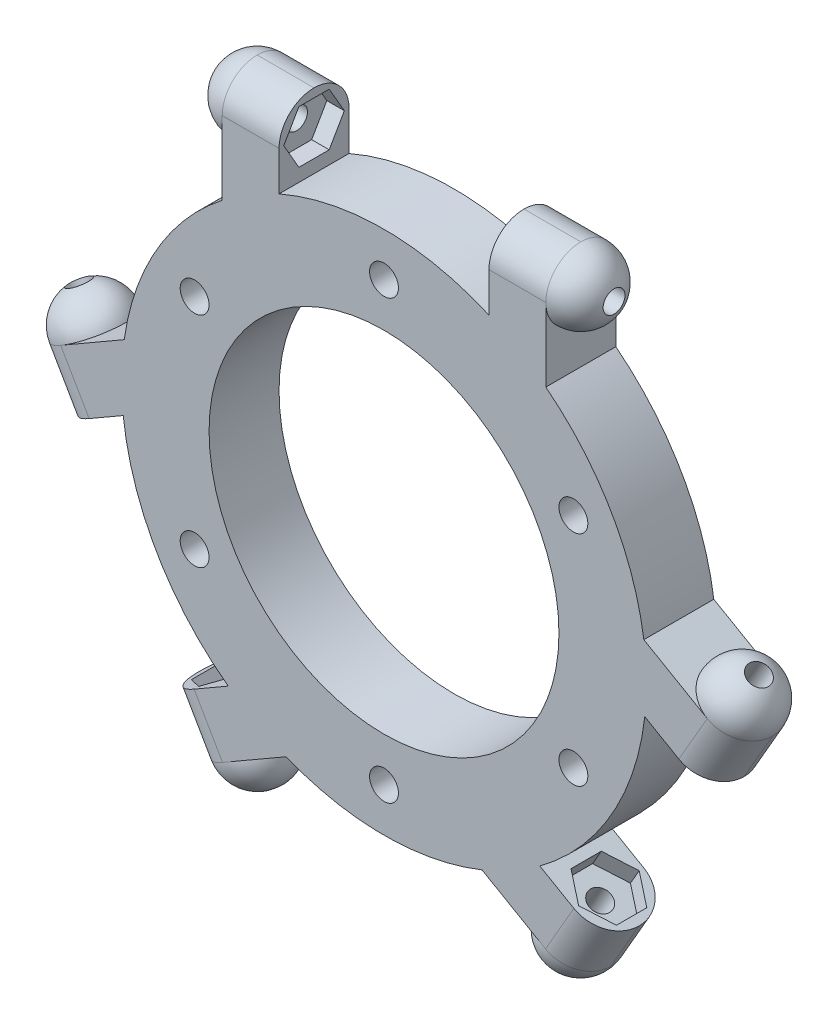
from build123d import *
from build123d.topology import SkipClean

# Parameters (mm, degrees)
ESQUISSE1_R                  = 20
ESQUISSE1_R_2                = 1.65
BOSS_EXTRU_1_DEPTH           = 8
CONG_1_R                     = 4
ESQUISSE4_R                  = 1.25
ENL_V_MAT_EXTRU_2_DEPTH      = 46
ESQUISSE5_R                  = 1.25
ENL_V_MAT_EXTRU_3_DEPTH      = 46
ENL_V_START                  = -46
ESQUISSE2_R                  = 1.25
ENL_V_MAT_EXTRU_1_DEPTH      = 53
R_P_TITION_CIRCULAIRE1_COUNT = 3
ENL_V_MAT_EXTRU_4_DEPTH      = 2
ENL_V_MAT_EXTRU_5_DEPTH      = 2
R_P_TITION_CIRCULAIRE2_COUNT = 3


with BuildPart() as part:
    # Esquisse1 → Boss.-Extru.1 (new body)
    with BuildSketch(Plane.XY):
        with BuildLine():
            Line((-18.5, 35.99545417), (-18.5, 23.616731357))
            ThreePointArc((-18.5, 23.616731357), (-25.980762114, 15), (-29.70268931, 4.213104291))
            Line((-29.70268931, 4.213104291), (-40.422977732, -1.976257115))
            Line((-40.422977732, -1.976257115), (-37.172977732, -7.605422239))
            Line((-37.172977732, -7.605422239), (-29.8117618, -3.355422239))
            ThreePointArc((-29.8117618, -3.355422239), (-25.980762114, -15), (-17.8117618, -24.14003193))
            Line((-17.8117618, -24.14003193), (-25.172977732, -28.39003193))
            Line((-25.172977732, -28.39003193), (-21.922977732, -34.019197055))
            Line((-21.922977732, -34.019197055), (-11.20268931, -27.829835649))
            ThreePointArc((-11.20268931, -27.829835649), (0, -30), (11.20268931, -27.829835649))
            Line((11.20268931, -27.829835649), (21.922977732, -34.019197055))
            Line((21.922977732, -34.019197055), (25.172977732, -28.39003193))
            Line((25.172977732, -28.39003193), (17.8117618, -24.14003193))
            ThreePointArc((17.8117618, -24.14003193), (25.980762114, -15), (29.8117618, -3.355422239))
            Line((29.8117618, -3.355422239), (37.172977732, -7.605422239))
            Line((37.172977732, -7.605422239), (40.422977732, -1.976257115))
            Line((40.422977732, -1.976257115), (29.70268931, 4.213104291))
            ThreePointArc((29.70268931, 4.213104291), (25.980762114, 15), (18.5, 23.616731357))
            Line((18.5, 23.616731357), (18.5, 35.99545417))
            Line((18.5, 35.99545417), (12, 35.99545417))
            Line((12, 35.99545417), (12, 27.49545417))
            ThreePointArc((12, 27.49545417), (0, 30), (-12, 27.49545417))
            Line((-12, 27.49545417), (-12, 35.99545417))
            Line((-12, 35.99545417), (-18.5, 35.99545417))
        make_face()
        Circle(ESQUISSE1_R, mode=Mode.SUBTRACT)
        with Locations((0, 25)):
            Circle(ESQUISSE1_R_2, mode=Mode.SUBTRACT)
        with Locations((21.650635095, 12.5)):
            Circle(ESQUISSE1_R_2, mode=Mode.SUBTRACT)
        with Locations((21.650635095, -12.5)):
            Circle(ESQUISSE1_R_2, mode=Mode.SUBTRACT)
        with Locations((0, -25)):
            Circle(ESQUISSE1_R_2, mode=Mode.SUBTRACT)
        with Locations((-21.650635095, -12.5)):
            Circle(ESQUISSE1_R_2, mode=Mode.SUBTRACT)
        with Locations((-21.650635095, 12.5)):
            Circle(ESQUISSE1_R_2, mode=Mode.SUBTRACT)
    extrude(amount=BOSS_EXTRU_1_DEPTH)

    # Congé1
    cong_1_edges = [part.edges().sort_by_distance(p)[0] for p in [
        (38.797977732, -4.790839677, 0),
        (38.797977732, -4.790839677, 8),
        (23.547977732, -31.204614493, 0),
        (23.547977732, -31.204614493, 8),
        (15.25, 35.99545417, 0),
        (15.25, 35.99545417, 8),
        (-15.25, 35.99545417, 0),
        (-15.25, 35.99545417, 8),
        (-38.797977732, -4.790839677, 0),
        (-38.797977732, -4.790839677, 8),
        (-23.547977732, -31.204614493, 0),
        (-23.547977732, -31.204614493, 8),
    ]]
    fillet(cong_1_edges, radius=CONG_1_R - 0.0001)  # a hair under: the kernel refuses the full size

    # Esquisse4 → Enlèv. mat.-Extru.2 (cut)
    with BuildSketch(Plane(origin=(9.25, -16.02146997, 0), x_dir=(0.866025403784439, 0.4999999999999994, 0), z_dir=(0.4999999999999994, -0.866025403784439, 0))):
        with Locations((-31.99545417, 4)):
            Circle(ESQUISSE4_R)
    extrude(amount=-ENL_V_MAT_EXTRU_2_DEPTH, mode=Mode.SUBTRACT)

    # Esquisse5 → Enlèv. mat.-Extru.3 (cut)
    with BuildSketch(Plane(origin=(-9.25, -16.02146997, 0), x_dir=(0.8660254037844386, -0.5000000000000002, 0), z_dir=(-0.5000000000000001, -0.8660254037844385, 0))):
        with Locations((31.99545417, 4)):
            Circle(ESQUISSE5_R)
    extrude(amount=-ENL_V_MAT_EXTRU_3_DEPTH, mode=Mode.SUBTRACT)

    # Esquisse7 → Révolution2 (revolve)
    with BuildSketch(Plane.XY.offset(4)):
        with BuildLine():
            Line((-18.5, 35.99545417), (-18.5, 31.99545417))
            Line((-18.5, 31.99545417), (-22.5, 31.99545417))
            ThreePointArc((-22.5, 31.99545417), (-21.328427125, 34.823881294), (-18.5, 35.99545417))
        make_face()
        with BuildLine():
            Line((18.5, 31.99545417), (22.5, 31.99545417))
            ThreePointArc((22.5, 31.99545417), (21.328427125, 34.823881294), (18.5, 35.99545417))
            Line((18.5, 35.99545417), (18.5, 31.99545417))
        make_face()
    r_volution2 = revolve(axis=Axis((-22.5, 31.99545417, 4), (-1, 0, 0)))

    # Esquisse2 → Enlèv. mat.-Extru.1 (cut)
    with BuildSketch(Plane.ZY.offset(18.5).offset(ENL_V_START)):
        with Locations(Location((4, 31.99545417, 0), (0, 0, 90))):
            Circle(ESQUISSE2_R)
    enl_v_mat_extru_1 = extrude(amount=ENL_V_MAT_EXTRU_1_DEPTH, mode=Mode.SUBTRACT)

    # Répétition circulaire1: Révolution2, Enlèv. mat.-Extru.1 ×3 about axis
    with SkipClean():  # the faces are left unmerged after this step: merging them gives an invalid solid
        r_p_tition_circulaire1_axis = Axis((0, 0, 0), (0, 0, 1))
        add([r_volution2.rotate(r_p_tition_circulaire1_axis, i * 360 / R_P_TITION_CIRCULAIRE1_COUNT) for i in range(1, R_P_TITION_CIRCULAIRE1_COUNT)])
        add([enl_v_mat_extru_1.rotate(r_p_tition_circulaire1_axis, i * 360 / R_P_TITION_CIRCULAIRE1_COUNT) for i in range(1, R_P_TITION_CIRCULAIRE1_COUNT)], mode=Mode.SUBTRACT)

    # Esquisse8 → Enlèv. mat.-Extru.4 (cut)
    with SkipClean():  # the faces are left unmerged after this step: merging them gives an invalid solid
        with BuildSketch(Plane(origin=(-12, 0, 0), x_dir=(0, 0, -1), z_dir=(1, 0, 0))):
            Polygon((-0.535898385, 31.99545417), (-2.267949192, 34.99545417), (-5.732050808, 34.99545417), (-7.464101615, 31.99545417), (-5.732050808, 28.99545417), (-2.267949192, 28.99545417), align=None)
        enl_v_mat_extru_4 = extrude(amount=-ENL_V_MAT_EXTRU_4_DEPTH, mode=Mode.SUBTRACT)

    # Esquisse9 → Enlèv. mat.-Extru.5 (cut)
    with SkipClean():  # the faces are left unmerged after this step: merging them gives an invalid solid
        with BuildSketch(Plane.ZY.offset(-12)):
            Polygon((0.535898385, 31.99545417), (2.267949192, 28.99545417), (5.732050808, 28.99545417), (7.464101615, 31.99545417), (5.732050808, 34.99545417), (2.267949192, 34.99545417), align=None)
        enl_v_mat_extru_5 = extrude(amount=-ENL_V_MAT_EXTRU_5_DEPTH, mode=Mode.SUBTRACT)

    # Répétition circulaire2: Enlèv. mat.-Extru.4, Enlèv. mat.-Extru.5 ×3 about axis
    with SkipClean():  # the faces are left unmerged after this step: merging them gives an invalid solid
        r_p_tition_circulaire2_axis = Axis((0, 0, 0), (0, 0, 1))
        add([enl_v_mat_extru_4.rotate(r_p_tition_circulaire2_axis, i * 360 / R_P_TITION_CIRCULAIRE2_COUNT) for i in range(1, R_P_TITION_CIRCULAIRE2_COUNT)], mode=Mode.SUBTRACT)
        add([enl_v_mat_extru_5.rotate(r_p_tition_circulaire2_axis, i * 360 / R_P_TITION_CIRCULAIRE2_COUNT) for i in range(1, R_P_TITION_CIRCULAIRE2_COUNT)], mode=Mode.SUBTRACT)


solid = part.part
